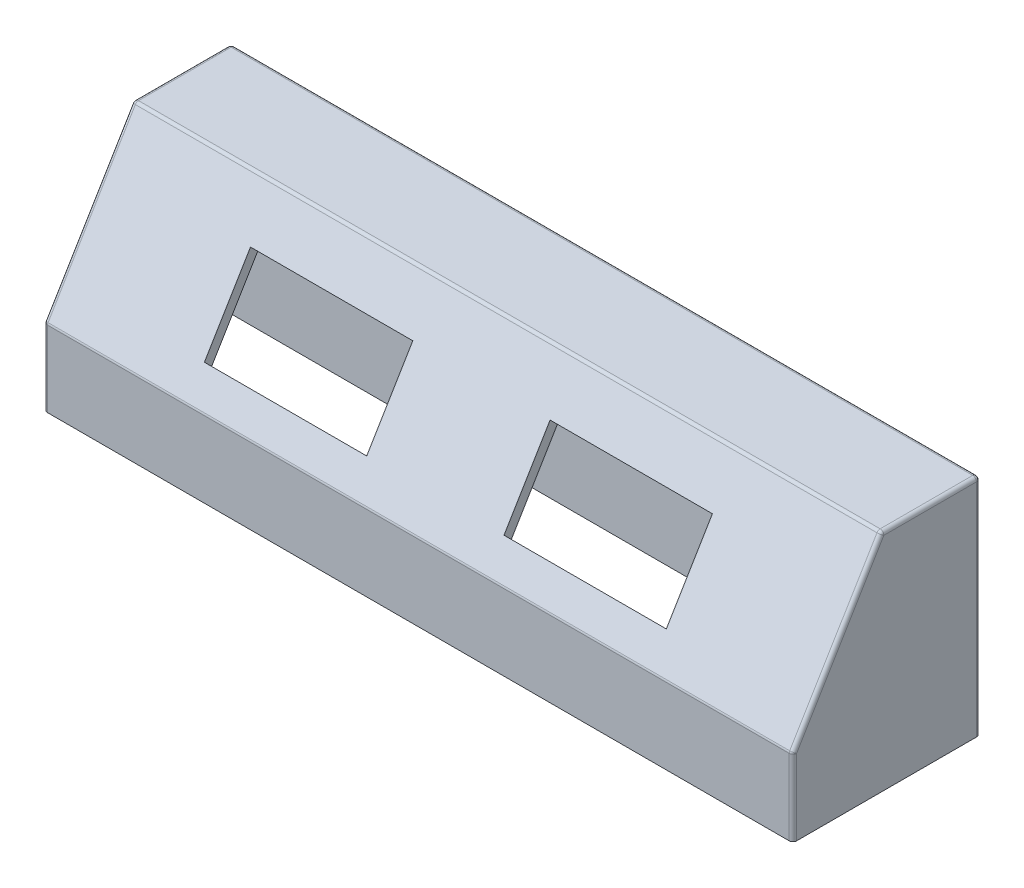
from build123d import *

# Parameters (mm, degrees)
SKETCH1_W           = 152.4
SKETCH1_H           = 38.1
BOSS_EXTRUDE1_DEPTH = 45.72
CUT_EXTRUDE1_REACH  = 162.247
SHELL1_T            = -2.032
CUT_EXTRUDE2_REACH  = 94.207
SKETCH4_W           = 33.02
SKETCH4_H           = 16.51
FILLET1_R           = 0.762
CHAMFER1_SIZE       = 5.08
CHAMFER1_SIZE_2     = 3.052371945


with BuildPart() as part:
    # Sketch1 → Boss-Extrude1 (new body)
    with BuildSketch(Plane(origin=(0, 0, 0), x_dir=(1, 0, 0), z_dir=(0, 1, 0))):
        Rectangle(SKETCH1_W, SKETCH1_H)
    extrude(amount=BOSS_EXTRUDE1_DEPTH)

    # Sketch3 → Cut-Extrude1 (cut, up to next)
    with BuildSketch(Plane(origin=(76.2, 0, 0), x_dir=(0, 0, -1), z_dir=(1, 0, 0)), mode=Mode.PRIVATE) as cut_extrude1_sk1:
        Polygon((-19.05, 15.63096767), (-0.970685408, 45.72), (-19.05, 45.72), align=None)
    cut_extrude1_tool1 = extrude(cut_extrude1_sk1.sketch, amount=-CUT_EXTRUDE1_REACH, mode=Mode.PRIVATE) & part.part
    add(cut_extrude1_tool1.solids().sort_by_distance((76.2, 35.690323, 13.023562))[0], mode=Mode.SUBTRACT)

    # Shell1
    shell1_openings = [part.faces().sort_by_distance(p)[0] for p in [
        (0, 0, 0),
    ]]
    offset(amount=SHELL1_T, openings=shell1_openings, kind=Kind.INTERSECTION)

    # Sketch4 → Cut-Extrude2 (cut, up to next)
    with BuildSketch(Plane(origin=(0, 12.556412247, 20.897379275), x_dir=(1, 0, 0), z_dir=(0, 0.5150380749100518, 0.8571673007021139)), mode=Mode.PRIVATE) as cut_extrude2_sk1:
        with Locations((-30.48, 20.249314041)):
            Rectangle(SKETCH4_W, SKETCH4_H)
    cut_extrude2_tool1 = extrude(cut_extrude2_sk1.sketch, amount=-CUT_EXTRUDE2_REACH, mode=Mode.PRIVATE) & part.part
    # Sketch4 → Cut-Extrude2 (cut, up to next)
    with BuildSketch(Plane(origin=(0, 12.556412247, 20.897379275), x_dir=(1, 0, 0), z_dir=(0, 0.5150380749100518, 0.8571673007021139)), mode=Mode.PRIVATE) as cut_extrude2_sk2:
        with Locations((30.48, 20.249314041)):
            Rectangle(SKETCH4_W, SKETCH4_H)
    cut_extrude2_tool2 = extrude(cut_extrude2_sk2.sketch, amount=-CUT_EXTRUDE2_REACH, mode=Mode.PRIVATE) & part.part
    add(cut_extrude2_tool1.solids().sort_by_distance((-30.48, 29.913462, 10.468212))[0], mode=Mode.SUBTRACT)
    add(cut_extrude2_tool2.solids().sort_by_distance((30.48, 29.913462, 10.468212))[0], mode=Mode.SUBTRACT)

    # Fillet1
    fillet1_edges = [part.edges().sort_by_distance(p)[0] for p in [
        (-76.2, 45.72, -9.039657296),
        (76.2, 45.72, -9.039657296),
        (76.2, 7.815483835, 19.05),
        (-76.2, 7.815483835, 19.05),
        (-76.2, 30.675483835, 10.010342704),
        (0, 45.72, 0.970685408),
        (76.2, 30.675483835, 10.010342704),
        (0, 15.63096767, 19.05),
        (-76.2, 22.86, -19.05),
        (76.2, 22.86, -19.05),
        (0, 45.72, -19.05),
    ]]
    fillet(fillet1_edges, radius=FILLET1_R)

    # Chamfer1
    # the kernel refuses this chamfer: 5.08, 3.052371945 mm, written as the material it takes off along each edge
    with BuildSketch(Plane(origin=(46.99, 21.790988669, 12.978086906), x_dir=(0, -0.8672541037770177, 0.4978657645208413), z_dir=(-1, 0, 0)), Plane(origin=(-13.97, 21.790988669, 12.978086906), x_dir=(0, -0.8672541037770181, 0.49786576452084075), z_dir=(-1, 0, 0))) as chamfer1_piece_1:
        Polygon((CHAMFER1_SIZE * 0.99980168408, CHAMFER1_SIZE * 0.0199146305808), (-CHAMFER1_SIZE_2 * 0.0199146305786, CHAMFER1_SIZE_2 * 0.999801683968), (0, 0), align=None)
    extrude(amount=33.02, mode=Mode.SUBTRACT)


solid = part.part
